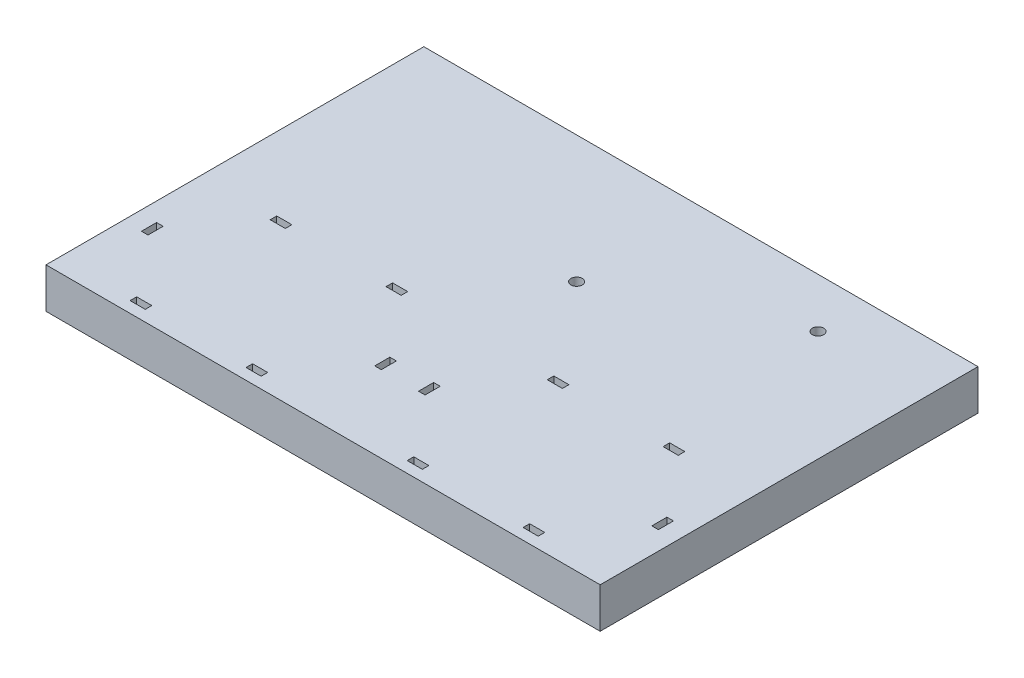
from build123d import *

# Parameters (mm, degrees)
SKETCH1_W           = 110
SKETCH1_H           = 75
SKETCH1_R           = 1.13
SKETCH1_W_2         = 3
SKETCH1_H_2         = 1.3
SKETCH1_W_3         = 1.3
SKETCH1_H_3         = 3
BOSS_EXTRUDE1_DEPTH = 8


with BuildPart() as part:
    # Sketch1 → Boss-Extrude1 (new body)
    with BuildSketch(Plane(origin=(0, 0, 0), x_dir=(1, 0, 0), z_dir=(0, 1, 0))):
        Rectangle(SKETCH1_W, SKETCH1_H)
        with Locations((33.07, 27.68)):
            Circle(SKETCH1_R, mode=Mode.SUBTRACT)
        with Locations((0.56, 12.26)):
            Circle(SKETCH1_R, mode=Mode.SUBTRACT)
        with Locations((16, -34.65)):
            Rectangle(SKETCH1_W_2, SKETCH1_H_2, mode=Mode.SUBTRACT)
        with Locations((16, -6.85)):
            Rectangle(SKETCH1_W_2, SKETCH1_H_2, mode=Mode.SUBTRACT)
        with Locations((39, -6.85)):
            Rectangle(SKETCH1_W_2, SKETCH1_H_2, mode=Mode.SUBTRACT)
        with Locations((39, -34.65)):
            Rectangle(SKETCH1_W_2, SKETCH1_H_2, mode=Mode.SUBTRACT)
        with Locations((50.65, -20.75)):
            Rectangle(SKETCH1_W_3, SKETCH1_H_3, mode=Mode.SUBTRACT)
        with Locations((4.35, -20.75)):
            Rectangle(SKETCH1_W_3, SKETCH1_H_3, mode=Mode.SUBTRACT)
        with Locations((-50.65, -20.75)):
            Rectangle(SKETCH1_W_3, SKETCH1_H_3, mode=Mode.SUBTRACT)
        with Locations((-4.35, -20.75)):
            Rectangle(SKETCH1_W_3, SKETCH1_H_3, mode=Mode.SUBTRACT)
        with Locations((-39, -34.65)):
            Rectangle(SKETCH1_W_2, SKETCH1_H_2, mode=Mode.SUBTRACT)
        with Locations((-39, -6.85)):
            Rectangle(SKETCH1_W_2, SKETCH1_H_2, mode=Mode.SUBTRACT)
        with Locations((-16, -34.65)):
            Rectangle(SKETCH1_W_2, SKETCH1_H_2, mode=Mode.SUBTRACT)
        with Locations((-16, -6.85)):
            Rectangle(SKETCH1_W_2, SKETCH1_H_2, mode=Mode.SUBTRACT)
    extrude(amount=BOSS_EXTRUDE1_DEPTH)


solid = part.part
